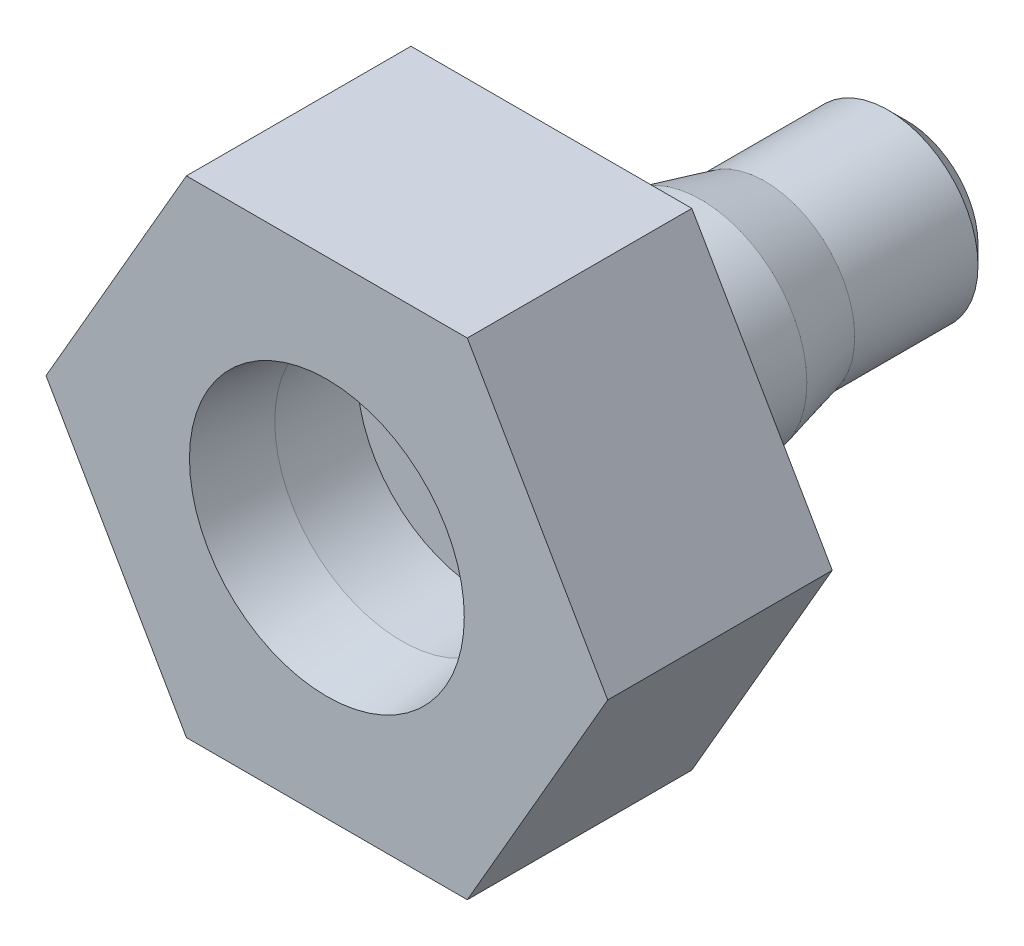
from build123d import *

# Parameters (mm, degrees)
SKETCH1_R           = 2.825
BOSS_EXTRUDE1_DEPTH = 9.5
SKETCH2_R           = 6.5
BOSS_EXTRUDE2_DEPTH = 6
SKETCH3_R           = 0.85
CUT_EXTRUDE1_DEPTH  = 15.5
SKETCH4_R           = 2.5
CUT_EXTRUDE2_DEPTH  = 4
CHAMFER1_SIZE       = 1
SKETCH10_R          = 0.85
BOSS_EXTRUDE5_DEPTH = 6
SKETCH11_R          = 2.825
SKETCH11_R_2        = 2.4
CUT_EXTRUDE3_DEPTH  = 6
CHAMFER2_SIZE       = 0.55
CHAMFER2_SIZE_2     = 2.205929513
CHAMFER3_SIZE       = 0.5
SKETCH12_R          = 3.3909
CUT_EXTRUDE4_DEPTH  = 4.2
CHAMFER4_SIZE       = 2
CHAMFER4_SIZE2      = 0.281081669


with BuildPart() as part:
    # Sketch1 → Boss-Extrude1 (new body)
    with BuildSketch(Plane.XY):
        Circle(SKETCH1_R)
    extrude(amount=BOSS_EXTRUDE1_DEPTH)

    # Sketch2 → Boss-Extrude2 (add)
    with BuildSketch(Plane.XY.offset(9.5)):
        Circle(SKETCH2_R)
    extrude(amount=BOSS_EXTRUDE2_DEPTH)

    # Sketch3 → Cut-Extrude1 (cut)
    with BuildSketch(Plane.XY.offset(15.5)):
        Circle(SKETCH3_R)
    extrude(amount=-CUT_EXTRUDE1_DEPTH, mode=Mode.SUBTRACT)

    # Sketch4 → Cut-Extrude2 (cut)
    with BuildSketch(Plane.XY.offset(15.5)):
        Circle(SKETCH4_R)
    extrude(amount=-CUT_EXTRUDE2_DEPTH, mode=Mode.SUBTRACT)

    # Chamfer1
    chamfer1_edges = [part.edges().sort_by_distance(p)[0] for p in [
        (-2.825, 0, 9.5),
    ]]
    chamfer(chamfer1_edges, length=CHAMFER1_SIZE)

    # Sketch10 → Boss-Extrude5 (add)
    with BuildSketch(Plane.XY.offset(15.5)):
        Polygon((3.75277675, 6.5), (-3.75277675, 6.5), (-7.505553499, 0), (-3.75277675, -6.5), (3.75277675, -6.5), (7.505553499, 0), align=None)
        Circle(SKETCH10_R, mode=Mode.SUBTRACT)
    extrude(amount=-BOSS_EXTRUDE5_DEPTH)

    # Sketch11 → Cut-Extrude3 (cut)
    with BuildSketch(Plane(origin=(0, 0, 0), x_dir=(-1, 0, 0), z_dir=(0, 0, -1))):
        with Locations(Location((0, 0, 0), (0, 0, 180))):
            Circle(SKETCH11_R)
        Circle(SKETCH11_R_2, mode=Mode.SUBTRACT)
    extrude(amount=-CUT_EXTRUDE3_DEPTH, mode=Mode.SUBTRACT)

    # Chamfer2
    # the kernel refuses this chamfer: 2.205929513, 0.55 mm, written as the material it adds along each edge
    with BuildSketch(Plane(origin=(0, 0, 6), x_dir=(-1, 0, 0), z_dir=(0, -1, 0))) as chamfer2_piece_1_section:
        Polygon((2.4 + CHAMFER2_SIZE, 0), (2.4, CHAMFER2_SIZE_2), (2.4, 0), align=None)
    chamfer2_piece_1 = revolve(axis=Axis((0, 0, 6), (0, 0, -1)), mode=Mode.PRIVATE)
    chamfer2_piece_1 = chamfer2_piece_1 & Plane(origin=(0, 0, 4.60896978), x_dir=(1, 0, 0), z_dir=(0, 0, -1)) * Cylinder(2.825, 12, mode=Mode.PRIVATE)
    add(chamfer2_piece_1)

    # Chamfer3
    chamfer3_edges = [part.edges().sort_by_distance(p)[0] for p in [
        (2.4, 0, 0),
    ]]
    chamfer(chamfer3_edges, length=CHAMFER3_SIZE)

    # Sketch12 → Cut-Extrude4 (cut)
    with BuildSketch(Plane.XY.offset(15.5)):
        Circle(SKETCH12_R)
    extrude(amount=-CUT_EXTRUDE4_DEPTH, mode=Mode.SUBTRACT)

    # Chamfer4
    chamfer4_edges = [part.edges().sort_by_distance(p)[0] for p in [
        (-3.3909, 0, 15.5),
    ]]
    chamfer4_side = [part.faces().sort_by_distance(p)[0] for p in [
        (-3.3909, 0, 13.4),
    ]]
    chamfer(chamfer4_edges, length=CHAMFER4_SIZE, length2=CHAMFER4_SIZE2, reference=chamfer4_side[0])


solid = part.part
